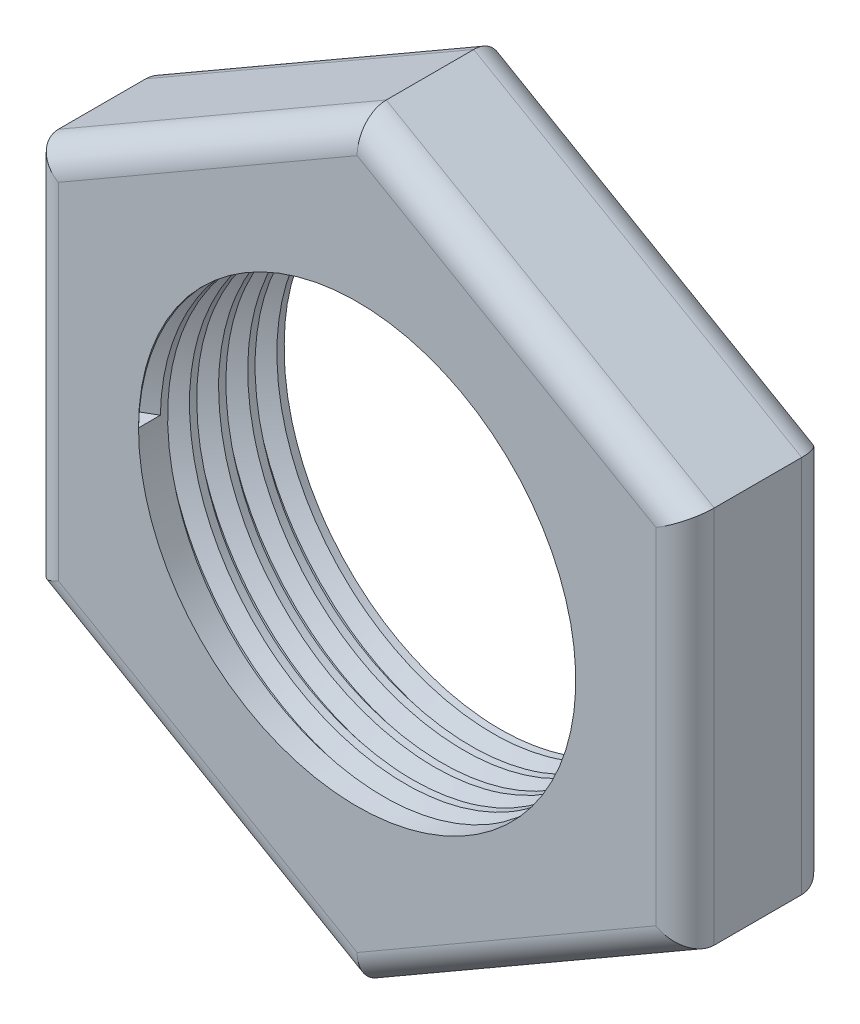
from build123d import *

# Parameters (mm, degrees)
IZIM1_R                     = 15
Y_KSEKLIK_EKSTR_ZYON1_DEPTH = 10
DI_2_PITCH                  = 2
RADYUS1_R                   = 2
RADYUS3_R                   = 2


with BuildPart() as part:
    # Çizim1 → Yükseklik-Ekstrüzyon1 (new body)
    with BuildSketch(Plane.XY):
        Polygon((0, 25.980762114), (-22.5, 12.990381057), (-22.5, -12.990381057), (0, -25.980762114), (22.5, -12.990381057), (22.5, 12.990381057), align=None)
        Circle(IZIM1_R, mode=Mode.SUBTRACT)
    extrude(amount=Y_KSEKLIK_EKSTR_ZYON1_DEPTH)

    # Diş2: the profile of Diş Profili2 profile screwed along a right-hand helix of 5 turns, 10 arcs to a turn; built about Z, then put on its axis
    di_2_z = Axis((0, 0, 0), (0, 0, 1))
    di_2_corners = [(14.9997, 0, -0.000173205), (16.08253175, 0, 0.624999997), (16.08253175, 0, 0.874999997), (14.9997, 0, 1.5001732)]
    with BuildLine(mode=Mode.PRIVATE) as di_2_profile:
        Line(di_2_corners[0], di_2_corners[1])
        Line(di_2_corners[1], di_2_corners[2])
        Line(di_2_corners[2], di_2_corners[3])
        Line(di_2_corners[3], di_2_corners[0])
    di_2_cap = Face(di_2_profile.wire())
    di_2_turn_angles = [0, 18, 36, 54, 72, 90, 108, 126, 144, 162, 180, 198, 216, 234, 252, 270, 288, 306, 324, 342, 360]
    di_2_turn_weights = [1, 0.9510565162951535, 1, 0.9510565162951535, 1, 0.9510565162951535, 1, 0.9510565162951535, 1, 0.9510565162951535, 1, 0.9510565162951535, 1, 0.9510565162951535, 1, 0.9510565162951535, 1, 0.9510565162951535, 1, 0.9510565162951535, 1]
    di_2_turn_rails = [Edge.make_bspline([Vector(p[0], p[1], 0).rotate(di_2_z, di_2_turn_angles[k]) / di_2_turn_weights[k] + Vector(0, 0, p[2] + DI_2_PITCH * di_2_turn_angles[k] / 360) for k in range(21)], [0, 0, 0, 1, 1, 2, 2, 3, 3, 4, 4, 5, 5, 6, 6, 7, 7, 8, 8, 9, 9, 10, 10, 10], 2, di_2_turn_weights) for p in di_2_corners]
    di_2_turn_sides = [Face.make_surface_from_curves(di_2_turn_rails[p[0]], di_2_turn_rails[p[1]]) for p in [(0, 1), (1, 2), (2, 3), (3, 0)]]
    di_2 = Plane(origin=(0, 0, 10), x_dir=(-1, 0, 0), z_dir=(0, 0, -1)) * Solid(Shell([*[p.moved(Location((0, 0, DI_2_PITCH * i))) for i in range(5) for p in di_2_turn_sides], di_2_cap, di_2_cap.rotate(di_2_z, 1800).moved(Location((0, 0, DI_2_PITCH * 1800 / 360)))]))
    add(di_2, mode=Mode.SUBTRACT)

    # Radyus1
    radyus1_edges = [part.edges().sort_by_distance(p)[0] for p in [
        (-22.5, 0, 10),
        (-11.25, -19.485571585, 10),
        (11.25, -19.485571585, 10),
        (22.5, 0, 10),
        (11.25, 19.485571585, 10),
        (-11.25, 19.485571585, 10),
    ]]
    fillet(radyus1_edges, radius=RADYUS1_R)

    # Radyus3
    radyus3_edges = [part.edges().sort_by_distance(p)[0] for p in [
        (22.5, 0, 0),
        (11.25, -19.485571585, 0),
        (-11.25, -19.485571585, 0),
        (-22.5, 0, 0),
        (-11.25, 19.485571585, 0),
        (11.25, 19.485571585, 0),
    ]]
    fillet(radyus3_edges, radius=RADYUS3_R)


solid = part.part
